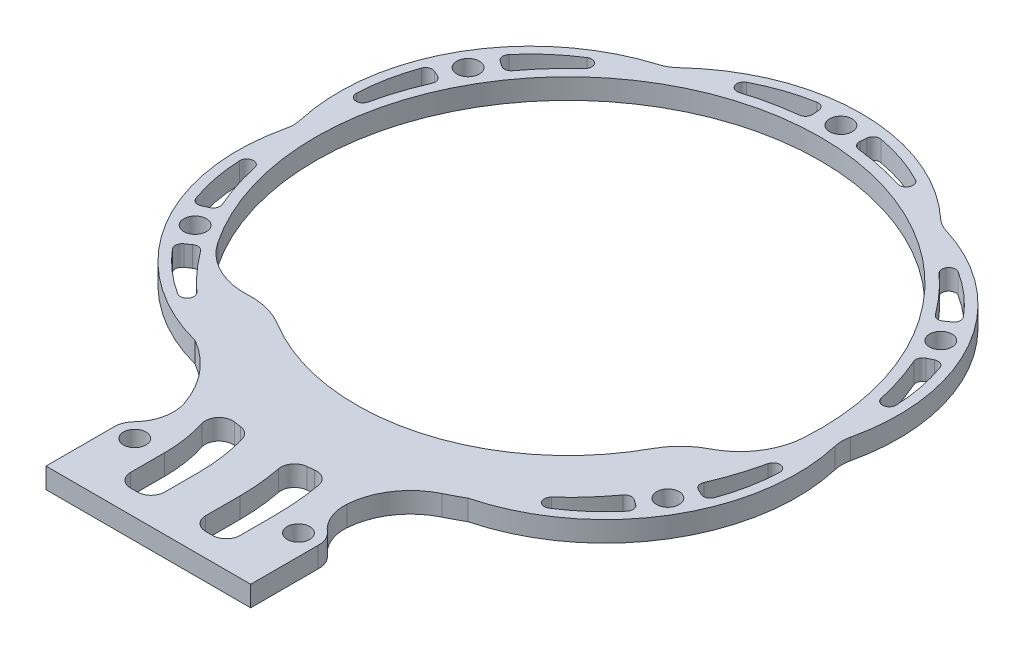
from build123d import *

# Parameters (mm, degrees)
SWEEP_2_DEPTH                   = 3
SKETCH_15_W                     = 3
SKETCH_15_H                     = 8
EXTRUDE_12_DEPTH                = 2
SKETCH_17_W                     = 3
SKETCH_17_H                     = 8
REVOLVE_1_ANGLE                 = 60
SKETCH_20_R                     = 26.546275206
EXTRUDE_1_DEPTH                 = 3
SKETCH_21_R                     = 12.5
CUT_EXTRUDE_1_DEPTH             = 10
CUT_EXTRUDE_2_REACH             = 65.063
SKETCH_22_R                     = 20
EXTRUDE_START                   = 22
SKETCH_23_R                     = 17
SKETCH_23_R_2                   = 12.5
EXTRUDE_2_DEPTH                 = 22
SKETCH_24_R                     = 55.165528931
CUT_EXTRUDE_3_DEPTH             = 67.603303222
SKETCH_25_R                     = 1.4
CUT_EXTRUDE_4_DEPTH             = 10
SKETCH_26_R                     = 3
EXTRUDE_3_DEPTH                 = 3
SKETCH_27_R                     = 1.65
CUT_EXTRUDE_5_DEPTH             = 3
SKETCH_28_R                     = 37
CUT_EXTRUDE_6_DEPTH             = 10
FILLET_1_R                      = 10
SKETCH_29_W                     = 24
SKETCH_29_H                     = 3
EXTRUDE_4_DEPTH                 = 13
SKETCH_30_R                     = 3
EXTRUDE_5_DEPTH                 = 3
SKETCH_31_R                     = 1.35
CUT_EXTRUDE_7_DEPTH             = 3
FILLET_2_R                      = 6
EXTRUDE_7_DEPTH                 = 3
EXTRUDE_START_2                 = -3
SKETCH_33_R                     = 37
SKETCH_33_R_2                   = 1.65
EXTRUDE_8_DEPTH                 = 3
CUT_EXTRUDE_START               = -10
CUT_EXTRUDE_8_DEPTH             = 10
EXTRUDE_9_DEPTH                 = 3
PATTERN_CIRCULAR_1_COUNT        = 3
PATTERN_CIRCULAR_1_ANGLE        = 120
PATTERN_START                   = -3
PATTERN_CIRCULAR_1_COPY_1_DEPTH = 3
PATTERN_CIRCULAR_1_COPY_2_DEPTH = 3
MIRROR_START                    = -3
MIRROR_2_COPY_1_DEPTH           = 3
MIRROR_2_COPY_2_DEPTH           = 3
MIRROR_2_COPY_3_DEPTH           = 3
MIRROR_2_COPY_4_DEPTH           = 3
MIRROR_2_COPY_5_DEPTH           = 3
EXTRUDE_10_DEPTH                = 3
FILLET_5_R                      = 5
MM_PRESS_1_D                    = 3.3
CUT_EXTRUDE_9_DEPTH             = 140.331676762
EXTRUDE_13_DEPTH                = 3
FILLET_7_R                      = 2
FILLET_8_R                      = 10
FILLET_9_R                      = 10


# Read off the part's stored shape, not the designer's step: 扫描2
with BuildPart() as part:
    # 扫描2 outline → 扫描2 (new body)
    with BuildSketch(Plane(origin=(0, 0, 0), x_dir=(1, 0, 0), z_dir=(0, 1, 0))):
        with BuildLine():
            ThreePointArc((-20, -34.641016151), (-14.143593539, -40.497422612), (-12, -48.497422612))
            Line((-12, -48.497422612), (12, -48.497422612))
            ThreePointArc((12, -48.497422612), (11.683405538, -43.474741562), (10.738633754, -38.531568163))
            ThreePointArc((10.738633754, -38.531568163), (5.02268105, 39.683405538), (-20, -34.641016151))
        make_face()
        with BuildLine():
            ThreePointArc((0, -19.931708898), (-3.808527847, -16.641925832), (-8, -13.856406461))
            ThreePointArc((-8, -13.856406461), (4.14110472, 15.454813221), (0, -16))
            Line((0, -16), (0, -19.931708898))
        make_face(mode=Mode.SUBTRACT)
    extrude(amount=SWEEP_2_DEPTH)

    # 扫描3: sweep along a path in 草图16
    with BuildLine(Plane(origin=(0, 3, 0), x_dir=(1, 0, 0), z_dir=(0, 1, 0))) as sweep_3_path:
        ThreePointArc((-12, -48.497422612), (-14.143593539, -40.497422612), (-20, -34.641016151))
        ThreePointArc((-20, -34.641016151), (5.02268105, 39.683405538), (10.738633754, -38.531568163))
    # 草图15 → 扫描3 (sweep)
    with BuildSketch(Plane.XY.offset(48.497422612)):
        with Locations((-10.5, 4)):
            Rectangle(SKETCH_15_W, SKETCH_15_H)
    sweep(path=sweep_3_path.line)

    # 草图42 → 凸台-拉伸12 (add)
    with BuildSketch(Plane(origin=(0, 0, 0), x_dir=(0.26846584384264915, 0, 0.9632892040762495), z_dir=(-0.9632892040762495, 0, 0.26846584384264915))):
        Polygon((37, 8), (37, 3), (38.4, 3), (40, 3), (40, 8), align=None)
    extrude(amount=EXTRUDE_12_DEPTH)

    # 草图17 → 旋转1 (revolve)
    with BuildSketch(Plane.XY.offset(48.497422612)):
        with Locations((10.5, 4)):
            Rectangle(SKETCH_17_W, SKETCH_17_H)
    revolve(axis=Axis((-28, 3, 48.497422612), (0, 1, 0)), revolution_arc=REVOLVE_1_ANGLE)

    # 草图20 → 凸台-拉伸1 (add)
    with BuildSketch(Plane(origin=(0, 3, 0), x_dir=(1, 0, 0), z_dir=(0, 1, 0))):
        Circle(SKETCH_20_R)
    extrude(amount=-EXTRUDE_1_DEPTH)

    # 草图21 → 切除-拉伸1 (cut)
    with BuildSketch(Plane(origin=(0, 3, 0), x_dir=(1, 0, 0), z_dir=(0, 1, 0))):
        with Locations(Location((0, 0, 0), (0, 0, 270))):
            Circle(SKETCH_21_R)
    extrude(amount=-CUT_EXTRUDE_1_DEPTH, mode=Mode.SUBTRACT)

    # 草图22 → 切除-拉伸2 (cut, up to next)
    with BuildSketch(Plane(origin=(0, 3, 0), x_dir=(1, 0, 0), z_dir=(0, 1, 0)), mode=Mode.PRIVATE) as cut_extrude_2_sk1:
        Circle(SKETCH_22_R)
    cut_extrude_2_tool1 = extrude(cut_extrude_2_sk1.sketch, amount=CUT_EXTRUDE_2_REACH, mode=Mode.PRIVATE) & part.part
    add(cut_extrude_2_tool1.solids().sort_by_distance((0, 3, 0))[0], mode=Mode.SUBTRACT)

    # 草图23 → 凸台-拉伸2 (add)
    with BuildSketch(Plane(origin=(0, 3, 0), x_dir=(1, 0, 0), z_dir=(0, 1, 0)).offset(EXTRUDE_START)):
        with Locations(Location((0, 0, 0), (0, 0, 270))):
            Circle(SKETCH_23_R)
        with Locations(Location((0, 0, 0), (0, 0, 270))):
            Circle(SKETCH_23_R_2, mode=Mode.SUBTRACT)
    extrude(amount=-EXTRUDE_2_DEPTH)

    # 草图24 → 切除-拉伸3 (cut, through all)
    with BuildSketch(Plane(origin=(0, 3, 0), x_dir=(1, 0, 0), z_dir=(0, 1, 0))):
        Circle(SKETCH_24_R)
    extrude(amount=CUT_EXTRUDE_3_DEPTH, mode=Mode.SUBTRACT)

    # 草图25 → 切除-拉伸4 (cut)
    with BuildSketch(Plane(origin=(0, 3, 0), x_dir=(1, 0, 0), z_dir=(0, 1, 0))):
        with Locations(Location((0, -14.75, 0), (0, 0, 270))):
            Circle(SKETCH_25_R)
        with Locations(Location((-12.773874706, 7.375, 0), (0, 0, 270))):
            Circle(SKETCH_25_R)
        with Locations(Location((12.773874706, 7.375, 0), (0, 0, 270))):
            Circle(SKETCH_25_R)
    extrude(amount=-CUT_EXTRUDE_4_DEPTH, mode=Mode.SUBTRACT)

    # 草图26 → 凸台-拉伸3 (add)
    with BuildSketch(Plane(origin=(0, 3, 0), x_dir=(1, 0, 0), z_dir=(0, 1, 0))):
        with Locations((0, 40)):
            Circle(SKETCH_26_R)
        with Locations((34.641016151, 20)):
            Circle(SKETCH_26_R)
        with Locations((34.641016151, -20)):
            Circle(SKETCH_26_R)
        with Locations((0, -40)):
            Circle(SKETCH_26_R)
        with Locations((-34.641016151, -20)):
            Circle(SKETCH_26_R)
        with Locations((-34.641016151, 20)):
            Circle(SKETCH_26_R)
    extrude(amount=-EXTRUDE_3_DEPTH)

    # 草图27 → 切除-拉伸5 (cut)
    with BuildSketch(Plane(origin=(0, 3, 0), x_dir=(1, 0, 0), z_dir=(0, 1, 0))):
        with Locations(Location((0, 40, 0), (0, 0, 270))):
            Circle(SKETCH_27_R)
        with Locations(Location((34.641016151, 20, 0), (0, 0, 270))):
            Circle(SKETCH_27_R)
        with Locations(Location((34.641016151, -20, 0), (0, 0, 270))):
            Circle(SKETCH_27_R)
        with Locations(Location((-34.641016151, -20, 0), (0, 0, 270))):
            Circle(SKETCH_27_R)
        with Locations(Location((-34.641016151, 20, 0), (0, 0, 270))):
            Circle(SKETCH_27_R)
    extrude(amount=-CUT_EXTRUDE_5_DEPTH, mode=Mode.SUBTRACT)

    # 草图28 → 切除-拉伸6 (cut)
    with BuildSketch(Plane.XZ):
        with Locations(Location((0, 0, 0), (0, 0, 270))):
            Circle(SKETCH_28_R)
    extrude(amount=-CUT_EXTRUDE_6_DEPTH, mode=Mode.SUBTRACT)

    # 圆角1
    fillet_1_edges = [part.edges().sort_by_distance(p)[0] for p in [
        (10.738633754, 1.5, 38.531568163),
    ]]
    fillet(fillet_1_edges, radius=FILLET_1_R)

    # 草图29 → 凸台-拉伸4 (add)
    with BuildSketch(Plane.XY.offset(48.497422612)):
        with Locations((0, 1.5)):
            Rectangle(SKETCH_29_W, SKETCH_29_H)
    extrude(amount=EXTRUDE_4_DEPTH)

    # 草图30 → 凸台-拉伸5 (add)
    with BuildSketch(Plane.XZ):
        with Locations((-12, 51.497422612)):
            Circle(SKETCH_30_R)
        with Locations((12, 51.497422612)):
            Circle(SKETCH_30_R)
    extrude(amount=-EXTRUDE_5_DEPTH)

    # 草图31 → 切除-拉伸7 (cut)
    with BuildSketch(Plane.XZ):
        with Locations(Location((12, 51.497422612, 0), (0, 0, 270))):
            Circle(SKETCH_31_R)
        with Locations(Location((-12, 51.497422612, 0), (0, 0, 270))):
            Circle(SKETCH_31_R)
    extrude(amount=-CUT_EXTRUDE_7_DEPTH, mode=Mode.SUBTRACT)

    # 圆角2
    # the kernel refuses this fillet: 6 mm, written as the material it adds along each edge
    with BuildSketch(Plane(origin=(-12, 0, 48.497422612), x_dir=(-0.9188891205468269, 0, 0.39451588579001345), z_dir=(0, 1, 0))) as fillet_2_piece_1:
        with BuildLine():
            CenterArc((4.73419063, -5.513334723), FILLET_2_R, 113.235784524, 62.181860715)
            ThreePointArc((-1.246630549, -5.033983053), (-0.828629151, -2.466146987), (0, 0))
            ThreePointArc((0, 0), (1.183547657, -0.243332638), (2.367095315, 0))
        make_face()
    extrude(amount=3)
    with BuildSketch(Plane(origin=(33.044643352, 3, -22.539998797), x_dir=(0.9763333982602803, 0, -0.21627088440549028), z_dir=(0, -1, 0)), Plane(origin=(36.042533235, 3, 17.347501204), x_dir=(0.6754627791459785, 0, 0.7373940832339184), z_dir=(0, -1, 0))) as fillet_2_piece_2:
        with BuildLine():
            CenterArc((4.037057174, -5.650269228), FILLET_2_R, 109.658997639, 43.86169752)
            ThreePointArc((-1.333515642, -2.975022018), (-0.636435164, -1.501102753), (0, 0))
            ThreePointArc((0, 0), (1.009264294, -0.174865386), (2.018528587, 0))
        make_face()
    extrude(amount=3)
    with BuildSketch(Plane(origin=(36.042533235, 3, -17.347501204), x_dir=(0.3966064660544948, 0, 0.9179887314579438), z_dir=(0, -1, 0)), Plane(origin=(33.044643352, 3, 22.539998797), x_dir=(-0.5966983288141339, 0, 0.8024656406291921), z_dir=(0, -1, 0)), Plane(origin=(2.997889883, 3, -39.8875), x_dir=(0.9933047948584526, 0, 0.11552309081394699), z_dir=(0, -1, 0))) as fillet_2_piece_3:
        with BuildLine():
            CenterArc((3.504734114, -5.995015577), FILLET_2_R, 92.335605783, 43.86169752)
            ThreePointArc((-0.825631791, -1.841952715), (-0.253247299, -0.992500944), (0, 0))
            ThreePointArc((0, 0), (1.63010889, -0.03322949), (3.26021778, 0))
        make_face()
    extrude(amount=3)
    with BuildSketch(Plane(origin=(-2.997889883, 3, -39.8875), x_dir=(0.30087061904832696, 0, -0.9536649676870157), z_dir=(0, -1, 0))) as fillet_2_piece_4:
        with BuildLine():
            CenterArc((4.037057174, -5.650269227), FILLET_2_R, 109.65899764, 43.861697522)
            ThreePointArc((-1.333515641, -2.975022018), (-0.636435164, -1.501102753), (0, 0))
            ThreePointArc((0, 0), (1.009264294, -0.174865386), (2.018528587, 0))
        make_face()
    extrude(amount=3)
    with BuildSketch(Plane(origin=(-36.042533235, 3, -17.347501204), x_dir=(-0.3966064660363216, 0, 0.9179887314657953), z_dir=(0, -1, 0))) as fillet_2_piece_5:
        with BuildLine():
            CenterArc((3.504734114, 5.995015577), FILLET_2_R, 223.80269669, 43.861697526)
            ThreePointArc((-0.82563179, 1.841952715), (-0.253247299, 0.992500944), (0, 0))
            ThreePointArc((0, 0), (1.63010889, 0.03322949), (3.260217781, 0))
        make_face()
    extrude(amount=3)
    with BuildSketch(Plane(origin=(-33.044643352, 3, -22.539998796), x_dir=(-0.9763333982183507, 0, -0.2162708845947773), z_dir=(0, -1, 0))) as fillet_2_piece_6:
        with BuildLine():
            CenterArc((4.037057175, 5.650269227), FILLET_2_R, 206.479304831, 43.861697526)
            ThreePointArc((-1.333515641, 2.975022019), (-0.636435164, 1.501102753), (0, 0))
            ThreePointArc((0, 0), (1.009264294, 0.174865386), (2.018528587, 0))
        make_face()
    extrude(amount=3)
    with BuildSketch(Plane(origin=(-33.044643352, 3, 22.539998796), x_dir=(0.5966983288105701, 0, 0.8024656406318421), z_dir=(0, -1, 0))) as fillet_2_piece_7:
        with BuildLine():
            CenterArc((3.504734114, 5.995015577), FILLET_2_R, 223.802696689, 43.861697528)
            ThreePointArc((-0.82563179, 1.841952715), (-0.253247299, 0.992500944), (0, 0))
            ThreePointArc((0, 0), (1.63010889, 0.03322949), (3.260217781, 0))
        make_face()
    extrude(amount=3)
    with BuildSketch(Plane(origin=(-36.042533235, 3, 17.347501203), x_dir=(-0.6754627793068153, 0, 0.7373940830865899), z_dir=(0, -1, 0))) as fillet_2_piece_8:
        with BuildLine():
            CenterArc((4.037057175, 5.650269227), FILLET_2_R, 206.479304829, 43.861697528)
            ThreePointArc((-1.333515641, 2.975022019), (-0.636435164, 1.501102753), (0, 0))
            ThreePointArc((0, 0), (1.009264294, 0.174865386), (2.018528588, 0))
        make_face()
    extrude(amount=3)
    with BuildSketch(Plane(origin=(-12, 3, 54.497422612), x_dir=(0, 0, 1), z_dir=(0, -1, 0))) as fillet_2_piece_9:
        with BuildLine():
            CenterArc((3.708203932, 6), FILLET_2_R, 221.810314896, 48.189685104)
            ThreePointArc((-0.763932023, 2), (-0.197482923, 1.070466269), (0, 0))
            Line((0, 0), (3.708203932, 0))
        make_face()
    extrude(amount=3)
    with BuildSketch(Plane(origin=(12, 3, 54.497422612), x_dir=(0, 0, 1), z_dir=(0, -1, 0))) as fillet_2_piece_10:
        with BuildLine():
            CenterArc((3.708203932, -6), FILLET_2_R, 90, 48.189685104)
            ThreePointArc((-0.763932023, -2), (-0.197482923, -1.070466269), (0, 0))
            Line((0, 0), (3.708203932, 0))
        make_face()
    extrude(amount=3)
    with BuildSketch(Plane(origin=(12, 0, 48.497422612), x_dir=(0.9371957750043113, 0, 0.3488037833998774), z_dir=(0, 1, 0))) as fillet_2_piece_11:
        with BuildLine():
            CenterArc((4.185645401, 5.62317465), FILLET_2_R, 196.491348694, 53.09448469)
            Line((-1.56753025, 3.919951256), (-2.142847815, 3.749628917))
            ThreePointArc((-2.142847815, 3.749628917), (-1.626796654, 2.367965564), (-0.562317465, -0.20928227))
            Line((-0.562317465, -0.20928227), (0.20928227, -0.562317465))
            ThreePointArc((0.20928227, -0.562317465), (1.04641135, -0.411587325), (1.88354043, -0.562317465))
            Line((1.88354043, -0.562317465), (2.092822701, 0))
        make_face()
    extrude(amount=3)

    # 草图32 → 凸台-拉伸7 (add)
    with BuildSketch(Plane.XZ):
        with BuildLine():
            Line((-26.162950904, 26.162950904), (-21.920310217, 21.920310217))
            ThreePointArc((-21.920310217, 21.920310217), (8.023390398, 29.943700615), (29.943700615, 8.023390398))
            Line((29.943700615, 8.023390398), (35.739255573, 9.576304669))
            ThreePointArc((35.739255573, 9.576304669), (9.576304669, 35.739255573), (-26.162950904, 26.162950904))
        make_face()
    extrude(amount=-EXTRUDE_7_DEPTH)

    # 草图33 → 凸台-拉伸8 (add)
    with BuildSketch(Plane(origin=(0, 3, 0), x_dir=(1, 0, 0), z_dir=(0, 1, 0)).offset(EXTRUDE_START_2)):
        with BuildLine():
            ThreePointArc((20, -34.641016151), (37.239092363, -21.5), (40, 0))
            ThreePointArc((40, 0), (37.239092363, 21.5), (20, 34.641016151))
            ThreePointArc((20, 34.641016151), (0, 43), (-20, 34.641016151))
            ThreePointArc((-20, 34.641016151), (-37.239092363, 21.5), (-40, 0))
            ThreePointArc((-40, 0), (-37.239092363, -21.5), (-20, -34.641016151))
            ThreePointArc((-20, -34.641016151), (0, -40), (20, -34.641016151))
        make_face()
        Circle(SKETCH_33_R, mode=Mode.SUBTRACT)
        with Locations(Location((34.641016151, 20, 0), (0, 0, 270))):
            Circle(SKETCH_33_R_2, mode=Mode.SUBTRACT)
        with Locations(Location((-34.641016151, -20, 0), (0, 0, 270))):
            Circle(SKETCH_33_R_2, mode=Mode.SUBTRACT)
        with Locations(Location((-34.641016151, 20, 0), (0, 0, 270))):
            Circle(SKETCH_33_R_2, mode=Mode.SUBTRACT)
        with Locations(Location((0, 40, 0), (0, 0, 270))):
            Circle(SKETCH_33_R_2, mode=Mode.SUBTRACT)
        with Locations(Location((34.641016151, -20, 0), (0, 0, 270))):
            Circle(SKETCH_33_R_2, mode=Mode.SUBTRACT)
        with BuildLine():
            Line((35.787683499, -16.688070883), (36.640757204, -17.085865685))
            ThreePointArc((36.640757204, -17.085865685), (37.447118524, -17.102997807), (38.003850346, -16.519421106))
            ThreePointArc((38.003850346, -16.519421106), (39.421833851, -10.463600437), (39.399954161, -4.244021474))
            ThreePointArc((39.399954161, -4.244021474), (39.241697198, -3.813031937), (38.907526139, -3.498187611))
            ThreePointArc((38.907526139, -3.498187611), (38.464215503, -3.81914461), (38.256253821, -4.325395195))
            ThreePointArc((38.256253821, -4.325395195), (37.188144312, -9.964533236), (35.29358526, -15.38222479))
            ThreePointArc((35.29358526, -15.38222479), (35.275014154, -16.135651629), (35.787683499, -16.688070883))
        make_face(mode=Mode.SUBTRACT)
        with BuildLine():
            Line((32.346135074, 22.649007611), (33.117172331, 23.18889371))
            ThreePointArc((33.117172331, 23.18889371), (33.535189843, 23.878657037), (33.308163506, 24.652589288))
            ThreePointArc((33.308163506, 24.652589288), (28.772660719, 28.908509361), (23.375407491, 31.999350474))
            ThreePointArc((23.375407491, 31.999350474), (22.923031122, 32.077790693), (22.483282408, 31.94581223))
            ThreePointArc((22.483282408, 31.94581223), (22.539584005, 31.401415457), (22.874029031, 30.968190065))
            ThreePointArc((22.874029031, 30.968190065), (27.223611076, 27.223611076), (30.968190065, 22.874029031))
            ThreePointArc((30.968190065, 22.874029031), (31.611391295, 22.481232562), (32.346135074, 22.649007611))
        make_face(mode=Mode.SUBTRACT)
        with BuildLine():
            Line((35.787683499, 16.688070883), (36.640757204, 17.085865685))
            ThreePointArc((36.640757204, 17.085865685), (37.447118524, 17.102997807), (38.003850346, 16.519421106))
            ThreePointArc((38.003850346, 16.519421106), (39.421833851, 10.463600437), (39.399954161, 4.244021474))
            ThreePointArc((39.399954161, 4.244021474), (39.241697198, 3.813031937), (38.907526139, 3.498187611))
            ThreePointArc((38.907526139, 3.498187611), (38.464215503, 3.81914461), (38.256253821, 4.325395195))
            ThreePointArc((38.256253821, 4.325395195), (37.188144312, 9.964533236), (35.29358526, 15.38222479))
            ThreePointArc((35.29358526, 15.38222479), (35.275014154, 16.135651629), (35.787683499, 16.688070883))
        make_face(mode=Mode.SUBTRACT)
        with BuildLine():
            Line((32.346135074, -22.649007611), (33.117172331, -23.18889371))
            ThreePointArc((33.117172331, -23.18889371), (33.535189843, -23.878657037), (33.308163506, -24.652589288))
            ThreePointArc((33.308163506, -24.652589288), (28.772660719, -28.908509361), (23.375407491, -31.999350474))
            ThreePointArc((23.375407491, -31.999350474), (22.923031122, -32.077790693), (22.483282408, -31.94581223))
            ThreePointArc((22.483282408, -31.94581223), (22.539584004, -31.401415457), (22.874029031, -30.968190065))
            ThreePointArc((22.874029031, -30.968190065), (27.223611076, -27.223611076), (30.968190065, -22.874029031))
            ThreePointArc((30.968190065, -22.874029031), (31.611391295, -22.481232562), (32.346135074, -22.649007611))
        make_face(mode=Mode.SUBTRACT)
        with BuildLine():
            Line((-35.787683499, -16.688070883), (-36.640757204, -17.085865685))
            ThreePointArc((-36.640757204, -17.085865685), (-37.447118524, -17.102997807), (-38.003850346, -16.519421106))
            ThreePointArc((-38.003850346, -16.519421106), (-39.421833851, -10.463600437), (-39.399954161, -4.244021474))
            ThreePointArc((-39.399954161, -4.244021474), (-39.241697198, -3.813031937), (-38.907526139, -3.498187611))
            ThreePointArc((-38.907526139, -3.498187611), (-38.464215503, -3.81914461), (-38.256253821, -4.325395195))
            ThreePointArc((-38.256253821, -4.325395195), (-37.188144312, -9.964533236), (-35.29358526, -15.38222479))
            ThreePointArc((-35.29358526, -15.38222479), (-35.275014154, -16.135651629), (-35.787683499, -16.688070883))
        make_face(mode=Mode.SUBTRACT)
        with BuildLine():
            Line((-32.346135074, 22.649007611), (-33.117172331, 23.18889371))
            ThreePointArc((-33.117172331, 23.18889371), (-33.535189843, 23.878657037), (-33.308163506, 24.652589288))
            ThreePointArc((-33.308163506, 24.652589288), (-28.772660719, 28.908509361), (-23.375407491, 31.999350474))
            ThreePointArc((-23.375407491, 31.999350474), (-22.923031122, 32.077790693), (-22.483282408, 31.94581223))
            ThreePointArc((-22.483282408, 31.94581223), (-22.539584004, 31.401415457), (-22.874029031, 30.968190065))
            ThreePointArc((-22.874029031, 30.968190065), (-27.223611076, 27.223611076), (-30.968190065, 22.874029031))
            ThreePointArc((-30.968190065, 22.874029031), (-31.611391295, 22.481232562), (-32.346135074, 22.649007611))
        make_face(mode=Mode.SUBTRACT)
        with BuildLine():
            Line((-35.787683499, 16.688070883), (-36.640757204, 17.085865685))
            ThreePointArc((-36.640757204, 17.085865685), (-37.447118524, 17.102997807), (-38.003850346, 16.519421106))
            ThreePointArc((-38.003850346, 16.519421106), (-39.421833851, 10.463600437), (-39.399954161, 4.244021474))
            ThreePointArc((-39.399954161, 4.244021474), (-39.241697198, 3.813031937), (-38.907526139, 3.498187611))
            ThreePointArc((-38.907526139, 3.498187611), (-38.464215503, 3.81914461), (-38.256253821, 4.325395195))
            ThreePointArc((-38.256253821, 4.325395195), (-37.188144312, 9.964533236), (-35.29358526, 15.38222479))
            ThreePointArc((-35.29358526, 15.38222479), (-35.275014154, 16.135651629), (-35.787683499, 16.688070883))
        make_face(mode=Mode.SUBTRACT)
        with BuildLine():
            Line((-32.346135074, -22.649007611), (-33.117172331, -23.18889371))
            ThreePointArc((-33.117172331, -23.18889371), (-33.535189843, -23.878657037), (-33.308163506, -24.652589288))
            ThreePointArc((-33.308163506, -24.652589288), (-28.772660719, -28.908509361), (-23.375407491, -31.999350474))
            ThreePointArc((-23.375407491, -31.999350474), (-22.923031122, -32.077790693), (-22.483282408, -31.94581223))
            ThreePointArc((-22.483282408, -31.94581223), (-22.539584005, -31.401415457), (-22.874029031, -30.968190065))
            ThreePointArc((-22.874029031, -30.968190065), (-27.223611076, -27.223611076), (-30.968190065, -22.874029031))
            ThreePointArc((-30.968190065, -22.874029031), (-31.611391295, -22.481232562), (-32.346135074, -22.649007611))
        make_face(mode=Mode.SUBTRACT)
        with BuildLine():
            Line((3.441548424, 39.337078494), (3.523584873, 40.274759395))
            ThreePointArc((3.523584873, 40.274759395), (3.91192868, 40.981654843), (4.69568684, 41.172010394))
            ThreePointArc((4.69568684, 41.172010394), (10.649173132, 39.372109797), (16.02454667, 36.243371948))
            ThreePointArc((16.02454667, 36.243371948), (16.318666076, 35.89082263), (16.424243732, 35.44399984))
            ThreePointArc((16.424243732, 35.44399984), (15.924631498, 35.220560067), (15.38222479, 35.29358526))
            ThreePointArc((15.38222479, 35.29358526), (9.964533236, 37.188144312), (4.325395195, 38.256253821))
            ThreePointArc((4.325395195, 38.256253821), (3.66362286, 38.616884191), (3.441548424, 39.337078494))
        make_face(mode=Mode.SUBTRACT)
        with BuildLine():
            Line((-3.441548424, 39.337078494), (-3.523584873, 40.274759395))
            ThreePointArc((-3.523584873, 40.274759395), (-3.91192868, 40.981654844), (-4.69568684, 41.172010394))
            ThreePointArc((-4.69568684, 41.172010394), (-10.649173132, 39.372109797), (-16.02454667, 36.243371948))
            ThreePointArc((-16.02454667, 36.243371948), (-16.318666076, 35.89082263), (-16.424243732, 35.44399984))
            ThreePointArc((-16.424243732, 35.44399984), (-15.924631498, 35.220560067), (-15.38222479, 35.29358526))
            ThreePointArc((-15.38222479, 35.29358526), (-9.964533236, 37.188144312), (-4.325395195, 38.256253821))
            ThreePointArc((-4.325395195, 38.256253821), (-3.66362286, 38.616884191), (-3.441548424, 39.337078494))
        make_face(mode=Mode.SUBTRACT)
    extrude(amount=EXTRUDE_8_DEPTH)

    # 草图34 → 切除-拉伸8 (cut)
    with BuildSketch(Plane(origin=(0, 3, 0), x_dir=(1, 0, 0), z_dir=(0, 1, 0)).offset(CUT_EXTRUDE_START)):
        with BuildLine():
            ThreePointArc((38.256253821, 4.325395195), (37.188144312, 9.964533236), (35.29358526, 15.38222479))
            ThreePointArc((35.29358526, 15.38222479), (35.275014154, 16.135651629), (35.787683499, 16.688070883))
            Line((35.787683499, 16.688070883), (36.640757204, 17.085865685))
            ThreePointArc((36.640757204, 17.085865685), (37.447118524, 17.102997807), (38.003850346, 16.519421106))
            ThreePointArc((38.003850346, 16.519421106), (39.421833851, 10.463600437), (39.399954161, 4.244021474))
            ThreePointArc((39.399954161, 4.244021474), (39.241697198, 3.813031937), (38.907526139, 3.498187611))
            ThreePointArc((38.907526139, 3.498187611), (38.464215503, 3.81914461), (38.256253821, 4.325395195))
        make_face()
        with BuildLine():
            Line((32.346135074, 22.649007611), (33.117172331, 23.18889371))
            ThreePointArc((33.117172331, 23.18889371), (33.535189843, 23.878657037), (33.308163506, 24.652589288))
            ThreePointArc((33.308163506, 24.652589288), (28.772660719, 28.908509361), (23.375407491, 31.999350474))
            ThreePointArc((23.375407491, 31.999350474), (22.923031122, 32.077790693), (22.483282408, 31.94581223))
            ThreePointArc((22.483282408, 31.94581223), (22.539584005, 31.401415457), (22.874029031, 30.968190065))
            ThreePointArc((22.874029031, 30.968190065), (27.223611076, 27.223611076), (30.968190065, 22.874029031))
            ThreePointArc((30.968190065, 22.874029031), (31.611391295, 22.481232562), (32.346135074, 22.649007611))
        make_face()
        with BuildLine():
            ThreePointArc((15.38222479, 35.29358526), (9.964533236, 37.188144312), (4.325395195, 38.256253821))
            ThreePointArc((4.325395195, 38.256253821), (3.66362286, 38.616884191), (3.441548424, 39.337078494))
            Line((3.441548424, 39.337078494), (3.523584873, 40.274759395))
            ThreePointArc((3.523584873, 40.274759395), (3.91192868, 40.981654843), (4.69568684, 41.172010394))
            ThreePointArc((4.69568684, 41.172010394), (10.649173132, 39.372109797), (16.02454667, 36.243371948))
            ThreePointArc((16.02454667, 36.243371948), (16.318666076, 35.89082263), (16.424243732, 35.44399984))
            ThreePointArc((16.424243732, 35.44399984), (15.924631498, 35.220560067), (15.38222479, 35.29358526))
        make_face()
        with BuildLine():
            Line((-3.441548424, 39.337078494), (-3.523584873, 40.274759395))
            ThreePointArc((-3.523584873, 40.274759395), (-3.91192868, 40.981654844), (-4.69568684, 41.172010394))
            ThreePointArc((-4.69568684, 41.172010394), (-10.649173132, 39.372109797), (-16.02454667, 36.243371948))
            ThreePointArc((-16.02454667, 36.243371948), (-16.318666076, 35.89082263), (-16.424243732, 35.44399984))
            ThreePointArc((-16.424243732, 35.44399984), (-15.924631498, 35.220560067), (-15.38222479, 35.29358526))
            ThreePointArc((-15.38222479, 35.29358526), (-9.964533236, 37.188144312), (-4.325395195, 38.256253821))
            ThreePointArc((-4.325395195, 38.256253821), (-3.66362286, 38.616884191), (-3.441548424, 39.337078494))
        make_face()
        with BuildLine():
            Line((35.787683499, -16.688070883), (36.640757204, -17.085865685))
            ThreePointArc((36.640757204, -17.085865685), (37.447118524, -17.102997807), (38.003850346, -16.519421106))
            ThreePointArc((38.003850346, -16.519421106), (39.421833851, -10.463600437), (39.399954161, -4.244021474))
            ThreePointArc((39.399954161, -4.244021474), (39.241697198, -3.813031937), (38.907526139, -3.498187611))
            ThreePointArc((38.907526139, -3.498187611), (38.464215503, -3.81914461), (38.256253821, -4.325395195))
            ThreePointArc((38.256253821, -4.325395195), (37.188144312, -9.964533236), (35.29358526, -15.38222479))
            ThreePointArc((35.29358526, -15.38222479), (35.275014154, -16.135651629), (35.787683499, -16.688070883))
        make_face()
        with BuildLine():
            ThreePointArc((22.874029031, -30.968190065), (27.223611076, -27.223611076), (30.968190065, -22.874029031))
            ThreePointArc((30.968190065, -22.874029031), (31.611391295, -22.481232562), (32.346135074, -22.649007611))
            Line((32.346135074, -22.649007611), (33.117172331, -23.18889371))
            ThreePointArc((33.117172331, -23.18889371), (33.535189843, -23.878657037), (33.308163506, -24.652589288))
            ThreePointArc((33.308163506, -24.652589288), (28.772660719, -28.908509361), (23.375407491, -31.999350474))
            ThreePointArc((23.375407491, -31.999350474), (22.923031122, -32.077790693), (22.483282408, -31.94581223))
            ThreePointArc((22.483282408, -31.94581223), (22.539584004, -31.401415457), (22.874029031, -30.968190065))
        make_face()
        with BuildLine():
            Line((-32.346135074, -22.649007611), (-33.117172331, -23.18889371))
            ThreePointArc((-33.117172331, -23.18889371), (-33.535189843, -23.878657037), (-33.308163506, -24.652589288))
            ThreePointArc((-33.308163506, -24.652589288), (-28.772660719, -28.908509361), (-23.375407491, -31.999350474))
            ThreePointArc((-23.375407491, -31.999350474), (-22.923031122, -32.077790693), (-22.483282408, -31.94581223))
            ThreePointArc((-22.483282408, -31.94581223), (-22.539584005, -31.401415457), (-22.874029031, -30.968190065))
            ThreePointArc((-22.874029031, -30.968190065), (-27.223611076, -27.223611076), (-30.968190065, -22.874029031))
            ThreePointArc((-30.968190065, -22.874029031), (-31.611391295, -22.481232562), (-32.346135074, -22.649007611))
        make_face()
        with BuildLine():
            ThreePointArc((-38.256253821, -4.325395195), (-37.188144312, -9.964533236), (-35.29358526, -15.38222479))
            ThreePointArc((-35.29358526, -15.38222479), (-35.275014154, -16.135651629), (-35.787683499, -16.688070883))
            Line((-35.787683499, -16.688070883), (-36.640757204, -17.085865685))
            ThreePointArc((-36.640757204, -17.085865685), (-37.447118524, -17.102997807), (-38.003850346, -16.519421106))
            ThreePointArc((-38.003850346, -16.519421106), (-39.421833851, -10.463600437), (-39.399954161, -4.244021474))
            ThreePointArc((-39.399954161, -4.244021474), (-39.241697198, -3.813031937), (-38.907526139, -3.498187611))
            ThreePointArc((-38.907526139, -3.498187611), (-38.464215503, -3.81914461), (-38.256253821, -4.325395195))
        make_face()
        with BuildLine():
            Line((-35.787683499, 16.688070883), (-36.640757204, 17.085865685))
            ThreePointArc((-36.640757204, 17.085865685), (-37.447118524, 17.102997807), (-38.003850346, 16.519421106))
            ThreePointArc((-38.003850346, 16.519421106), (-39.421833851, 10.463600437), (-39.399954161, 4.244021474))
            ThreePointArc((-39.399954161, 4.244021474), (-39.241697198, 3.813031937), (-38.907526139, 3.498187611))
            ThreePointArc((-38.907526139, 3.498187611), (-38.464215503, 3.81914461), (-38.256253821, 4.325395195))
            ThreePointArc((-38.256253821, 4.325395195), (-37.188144312, 9.964533236), (-35.29358526, 15.38222479))
            ThreePointArc((-35.29358526, 15.38222479), (-35.275014154, 16.135651629), (-35.787683499, 16.688070883))
        make_face()
        with BuildLine():
            ThreePointArc((-22.874029031, 30.968190065), (-27.223611076, 27.223611076), (-30.968190065, 22.874029031))
            ThreePointArc((-30.968190065, 22.874029031), (-31.611391295, 22.481232562), (-32.346135074, 22.649007611))
            Line((-32.346135074, 22.649007611), (-33.117172331, 23.18889371))
            ThreePointArc((-33.117172331, 23.18889371), (-33.535189843, 23.878657037), (-33.308163506, 24.652589288))
            ThreePointArc((-33.308163506, 24.652589288), (-28.772660719, 28.908509361), (-23.375407491, 31.999350474))
            ThreePointArc((-23.375407491, 31.999350474), (-22.923031122, 32.077790693), (-22.483282408, 31.94581223))
            ThreePointArc((-22.483282408, 31.94581223), (-22.539584004, 31.401415457), (-22.874029031, 30.968190065))
        make_face()
    extrude(amount=CUT_EXTRUDE_8_DEPTH, mode=Mode.SUBTRACT)

    # 草图37 → 凸台-拉伸9 (add)
    with BuildSketch(Plane(origin=(0, 3, 0), x_dir=(1, 0, 0), z_dir=(0, 1, 0)).offset(EXTRUDE_START_2)):
        with BuildLine():
            ThreePointArc((16.02454667, 36.243371948), (14.244574899, 37.469966079), (12.37119191, 38.548515494))
            ThreePointArc((12.37119191, 38.548515494), (12.763156639, 38.180344812), (12.90774964, 37.66238838))
            ThreePointArc((12.90774964, 37.66238838), (12.498738968, 36.855709005), (11.606286412, 36.708910577))
            ThreePointArc((11.606286412, 36.708910577), (13.512798402, 36.050718153), (15.38222479, 35.29358526))
            ThreePointArc((15.38222479, 35.29358526), (15.924631498, 35.220560067), (16.424243732, 35.44399984))
            ThreePointArc((16.424243732, 35.44399984), (16.318666076, 35.89082263), (16.02454667, 36.243371948))
        make_face()
    extrude_9 = extrude(amount=EXTRUDE_9_DEPTH)

    # 镜向1: 凸台-拉伸9 across plane
    add(extrude_9.mirror(Plane(origin=(0, 0, 0), x_dir=(0, 0, 1), z_dir=(1, 0, 0))))

    # 阵列(圆周)1: 凸台-拉伸9 ×3 about axis
    pattern_circular_1_axis = Axis((0, 0, 0), (0, -1, 0))
    for i in range(1, PATTERN_CIRCULAR_1_COUNT):
        add(extrude_9.rotate(pattern_circular_1_axis, i * PATTERN_CIRCULAR_1_ANGLE / (PATTERN_CIRCULAR_1_COUNT - 1)))

    # 阵列(圆周)1 copy 1 sketch → 阵列(圆周)1 copy 1 (add)
    with BuildSketch(Plane(origin=(0, 3, 0), x_dir=(-0.4999999999999978, 0, -0.8660254037844399), z_dir=(0, 1, 0)).offset(PATTERN_START)):
        with BuildLine():
            ThreePointArc((16.02454667, -36.243371948), (14.244574899, -37.469966079), (12.37119191, -38.548515494))
            ThreePointArc((12.37119191, -38.548515494), (12.763156639, -38.180344812), (12.90774964, -37.66238838))
            ThreePointArc((12.90774964, -37.66238838), (12.498738968, -36.855709005), (11.606286412, -36.708910577))
            ThreePointArc((11.606286412, -36.708910577), (13.512798402, -36.050718153), (15.38222479, -35.29358526))
            ThreePointArc((15.38222479, -35.29358526), (15.924631498, -35.220560067), (16.424243732, -35.44399984))
            ThreePointArc((16.424243732, -35.44399984), (16.318666076, -35.89082263), (16.02454667, -36.243371948))
        make_face()
    extrude(amount=PATTERN_CIRCULAR_1_COPY_1_DEPTH)

    # 阵列(圆周)1 copy 2 sketch → 阵列(圆周)1 copy 2 (add)
    with BuildSketch(Plane(origin=(0, 3, 0), x_dir=(0.5000000000000044, 0, -0.866025403784436), z_dir=(0, 1, 0)).offset(PATTERN_START)):
        with BuildLine():
            ThreePointArc((16.02454667, -36.243371948), (14.244574899, -37.469966079), (12.37119191, -38.548515494))
            ThreePointArc((12.37119191, -38.548515494), (12.763156639, -38.180344812), (12.90774964, -37.66238838))
            ThreePointArc((12.90774964, -37.66238838), (12.498738968, -36.855709005), (11.606286412, -36.708910577))
            ThreePointArc((11.606286412, -36.708910577), (13.512798402, -36.050718153), (15.38222479, -35.29358526))
            ThreePointArc((15.38222479, -35.29358526), (15.924631498, -35.220560067), (16.424243732, -35.44399984))
            ThreePointArc((16.424243732, -35.44399984), (16.318666076, -35.89082263), (16.02454667, -36.243371948))
        make_face()
    extrude(amount=PATTERN_CIRCULAR_1_COPY_2_DEPTH)

    # 镜向2 copy 1 sketch → 镜向2 copy 1 (add)
    with BuildSketch(Plane(origin=(0, 3, 0), x_dir=(-0.4999999999999978, 0, 0.8660254037844399), z_dir=(0, 1, 0)).offset(MIRROR_START)):
        with BuildLine():
            ThreePointArc((16.02454667, -36.243371948), (14.244574899, -37.469966079), (12.37119191, -38.548515494))
            ThreePointArc((12.37119191, -38.548515494), (12.763156639, -38.180344812), (12.90774964, -37.66238838))
            ThreePointArc((12.90774964, -37.66238838), (12.498738968, -36.855709005), (11.606286412, -36.708910577))
            ThreePointArc((11.606286412, -36.708910577), (13.512798402, -36.050718153), (15.38222479, -35.29358526))
            ThreePointArc((15.38222479, -35.29358526), (15.924631498, -35.220560067), (16.424243732, -35.44399984))
            ThreePointArc((16.424243732, -35.44399984), (16.318666076, -35.89082263), (16.02454667, -36.243371948))
        make_face()
    extrude(amount=MIRROR_2_COPY_1_DEPTH)

    # 镜向2 copy 2 sketch → 镜向2 copy 2 (add)
    with BuildSketch(Plane(origin=(0, 3, 0), x_dir=(0.5000000000000044, 0, 0.866025403784436), z_dir=(0, 1, 0)).offset(MIRROR_START)):
        with BuildLine():
            ThreePointArc((16.02454667, -36.243371948), (14.244574899, -37.469966079), (12.37119191, -38.548515494))
            ThreePointArc((12.37119191, -38.548515494), (12.763156639, -38.180344812), (12.90774964, -37.66238838))
            ThreePointArc((12.90774964, -37.66238838), (12.498738968, -36.855709005), (11.606286412, -36.708910577))
            ThreePointArc((11.606286412, -36.708910577), (13.512798402, -36.050718153), (15.38222479, -35.29358526))
            ThreePointArc((15.38222479, -35.29358526), (15.924631498, -35.220560067), (16.424243732, -35.44399984))
            ThreePointArc((16.424243732, -35.44399984), (16.318666076, -35.89082263), (16.02454667, -36.243371948))
        make_face()
    extrude(amount=MIRROR_2_COPY_2_DEPTH)

    # 镜向2 copy 3 sketch → 镜向2 copy 3 (add)
    with BuildSketch(Plane(origin=(0, 3, 0), x_dir=(0.4999999999999978, 0, -0.8660254037844399), z_dir=(0, 1, 0)).offset(MIRROR_START)):
        with BuildLine():
            ThreePointArc((16.02454667, 36.243371948), (14.244574899, 37.469966079), (12.37119191, 38.548515494))
            ThreePointArc((12.37119191, 38.548515494), (12.763156639, 38.180344812), (12.90774964, 37.66238838))
            ThreePointArc((12.90774964, 37.66238838), (12.498738968, 36.855709005), (11.606286412, 36.708910577))
            ThreePointArc((11.606286412, 36.708910577), (13.512798402, 36.050718153), (15.38222479, 35.29358526))
            ThreePointArc((15.38222479, 35.29358526), (15.924631498, 35.220560067), (16.424243732, 35.44399984))
            ThreePointArc((16.424243732, 35.44399984), (16.318666076, 35.89082263), (16.02454667, 36.243371948))
        make_face()
    extrude(amount=MIRROR_2_COPY_3_DEPTH)

    # 镜向2 copy 4 sketch → 镜向2 copy 4 (add)
    with BuildSketch(Plane(origin=(0, 3, 0), x_dir=(-0.5000000000000044, 0, -0.866025403784436), z_dir=(0, 1, 0)).offset(MIRROR_START)):
        with BuildLine():
            ThreePointArc((16.02454667, 36.243371948), (14.244574899, 37.469966079), (12.37119191, 38.548515494))
            ThreePointArc((12.37119191, 38.548515494), (12.763156639, 38.180344812), (12.90774964, 37.66238838))
            ThreePointArc((12.90774964, 37.66238838), (12.498738968, 36.855709005), (11.606286412, 36.708910577))
            ThreePointArc((11.606286412, 36.708910577), (13.512798402, 36.050718153), (15.38222479, 35.29358526))
            ThreePointArc((15.38222479, 35.29358526), (15.924631498, 35.220560067), (16.424243732, 35.44399984))
            ThreePointArc((16.424243732, 35.44399984), (16.318666076, 35.89082263), (16.02454667, 36.243371948))
        make_face()
    extrude(amount=MIRROR_2_COPY_4_DEPTH)

    # 镜向2 copy 5 sketch → 镜向2 copy 5 (add)
    with BuildSketch(Plane(origin=(0, 3, 0), x_dir=(-1, 0, 0), z_dir=(0, 1, 0)).offset(MIRROR_START)):
        with BuildLine():
            ThreePointArc((16.02454667, -36.243371948), (14.244574899, -37.469966079), (12.37119191, -38.548515494))
            ThreePointArc((12.37119191, -38.548515494), (12.763156639, -38.180344812), (12.90774964, -37.66238838))
            ThreePointArc((12.90774964, -37.66238838), (12.498738968, -36.855709005), (11.606286412, -36.708910577))
            ThreePointArc((11.606286412, -36.708910577), (13.512798402, -36.050718153), (15.38222479, -35.29358526))
            ThreePointArc((15.38222479, -35.29358526), (15.924631498, -35.220560067), (16.424243732, -35.44399984))
            ThreePointArc((16.424243732, -35.44399984), (16.318666076, -35.89082263), (16.02454667, -36.243371948))
        make_face()
    extrude(amount=MIRROR_2_COPY_5_DEPTH)

    # 草图38 → 凸台-拉伸10 (add)
    with BuildSketch(Plane(origin=(0, 3, 0), x_dir=(1, 0, 0), z_dir=(0, 1, 0))):
        with BuildLine():
            Line((14.999889849, -61.497422612), (14.999889849, -51.61942031))
            Line((14.999889849, -51.61942031), (14.997518401, -51.61942031))
            ThreePointArc((14.997518401, -51.61942031), (14.713138557, -52.777609775), (14, -53.733490589))
            ThreePointArc((14, -53.733490589), (12.522774425, -55.756136802), (12, -58.205626544))
            Line((12, -58.205626544), (12, -61.497422612))
            Line((12, -61.497422612), (14.999889849, -61.497422612))
        make_face()
        with BuildLine():
            ThreePointArc((-14, -53.733490589), (-14.713138557, -52.777609775), (-14.997518401, -51.61942031))
            Line((-14.997518401, -51.61942031), (-14.997518401, -61.497422612))
            Line((-14.997518401, -61.497422612), (-12, -61.497422612))
            Line((-12, -61.497422612), (-12, -58.205626544))
            ThreePointArc((-12, -58.205626544), (-12.522774425, -55.756136802), (-14, -53.733490589))
        make_face()
    extrude(amount=-EXTRUDE_10_DEPTH)

    # 圆角5
    fillet_5_edges = [part.edges().sort_by_distance(p)[0] for p in [
        (20, 1.5, -34.641016151),
        (40, 1.5, 0),
        (-20, 1.5, -34.641016151),
        (-40, 1.5, 0),
    ]]
    fillet(fillet_5_edges, radius=FILLET_5_R)

    # 大小mm Press 暗销孔1 (through all)
    with Locations(Plane(origin=(0, 3, 0), x_dir=(1, 0, 0), z_dir=(0, 1, 0))):
        with Locations((12, -51.497422612), (-12, -51.497422612)):
            Hole(MM_PRESS_1_D / 2)

    # 草图44 → 切除-拉伸9 (cut, through all)
    with BuildSketch(Plane(origin=(81.194664378, -21, -0.989898296), x_dir=(0.32280390283122534, 0, 0.9464658685430388), z_dir=(0, -1, 0))):
        with BuildLine():
            ThreePointArc((14.160637653, 83.874555913), (19.997234873, 84.560710043), (25.679315007, 86.060923347))
            Line((25.679315007, 86.060923347), (30.411644349, 87.674942861))
            ThreePointArc((30.411644349, 87.674942861), (31.561055069, 88.685883388), (31.658968281, 90.213482404))
            Line((31.658968281, 90.213482404), (31.326376666, 91.188645989))
            ThreePointArc((31.326376666, 91.188645989), (30.315436139, 92.338056708), (28.787837124, 92.43596992))
            Line((28.787837124, 92.43596992), (24.055507781, 90.821950406))
            ThreePointArc((24.055507781, 90.821950406), (18.558136353, 89.468038028), (12.909218709, 89.08869546))
            ThreePointArc((12.909218709, 89.08869546), (13.622399391, 86.502619204), (14.160637653, 83.874555913))
        make_face()
        with BuildLine():
            ThreePointArc((8.304834273, 98.905178177), (9.397586499, 97.11613036), (10.395107166, 95.272288707))
            ThreePointArc((10.395107166, 95.272288707), (16.326067504, 95.226388007), (22.118684364, 96.500745618))
            Line((22.118684364, 96.500745618), (26.851013707, 98.114765132))
            ThreePointArc((26.851013707, 98.114765132), (28.000424426, 99.125705659), (28.098337638, 100.653304674))
            Line((28.098337638, 100.653304674), (27.775533735, 101.599770543))
            ThreePointArc((27.775533735, 101.599770543), (26.764593208, 102.749181262), (25.236994192, 102.847094474))
            Line((25.236994192, 102.847094474), (20.50466485, 101.23307496))
            ThreePointArc((20.50466485, 101.23307496), (15.576715192, 100.176472459), (10.538185767, 100.296129967))
            ThreePointArc((10.538185767, 100.296129967), (9.350030831, 100.098731966), (8.490689647, 99.254806107))
            Line((8.490689647, 99.254806107), (8.304834273, 98.905178177))
        make_face()
    extrude(amount=-CUT_EXTRUDE_9_DEPTH, mode=Mode.SUBTRACT)

    # 草图43 → 凸台-拉伸13 (add)
    with BuildSketch(Plane(origin=(0, 3, 0), x_dir=(1, 0, 0), z_dir=(0, 1, 0)).offset(EXTRUDE_START_2)):
        with BuildLine():
            Line((-9.734878073, -38.797321414), (-10.005794135, -39.086088442))
            ThreePointArc((-10.005794135, -39.086088442), (-10.527142469, -40.171848102), (-10.330431889, -41.360117042))
            ThreePointArc((-10.330431889, -41.360117042), (-7.417664646, -41.980416338), (-4.468698449, -42.395846954))
            ThreePointArc((-4.468698449, -42.395846954), (-5.005373679, -40.982967913), (-5.621723938, -39.602982463))
            ThreePointArc((-5.621723938, -39.602982463), (-7.688860693, -39.254062481), (-9.734878073, -38.797321414))
        make_face()
        with BuildLine():
            ThreePointArc((1.867227926, -42.589794137), (4.459954432, -42.396767698), (7.036092736, -42.046052178))
            ThreePointArc((7.036092736, -42.046052178), (6.728997346, -40.761687545), (6.381369068, -39.487695917))
            ThreePointArc((6.381369068, -39.487695917), (3.720251451, -39.82662086), (1.042401034, -39.986415194))
            ThreePointArc((1.042401034, -39.986415194), (1.482171244, -41.279437239), (1.867227926, -42.589794137))
        make_face()
    extrude(amount=EXTRUDE_13_DEPTH)

    # 圆角7
    fillet_7_edges = [part.edges().sort_by_distance(p)[0] for p in [
        (-10.330431889, 1.5, 41.360117042),
        (-4.468698449, 1.5, 42.395846954),
        (7.036092736, 1.5, 42.046052178),
        (1.867227926, 1.5, 42.589794137),
    ]]
    fillet(fillet_7_edges, radius=FILLET_7_R)

    # 圆角8
    # the kernel refuses this fillet: 10 mm, written as the material it takes off along each edge
    with BuildSketch(Plane(origin=(-21.920310217, -18.236796634, 21.920310217), x_dir=(-0.7071067811865502, 0, 0.7071067811865449), z_dir=(0, 1, 0))) as fillet_8_piece_1:
        with BuildLine():
            CenterArc((8.864864865, 9.580842829), FILLET_8_R, 193.513772641, 59.838503827)
            Line((-0.858272907, 7.244051895), (-1.052735662, 7.197316076))
            ThreePointArc((-1.052735662, 7.197316076), (-0.413926849, 3.623827976), (-0.2, 0))
            Line((-0.2, 0), (0, -0.2))
            ThreePointArc((0, -0.2), (3, -0.2), (5.942702703, -0.191616857))
            Line((5.942702703, -0.191616857), (6, 0))
        make_face()
    extrude(amount=39.473593269, mode=Mode.SUBTRACT)
    with BuildSketch(Plane(origin=(29.943700615, -18.236796634, 8.023390398), x_dir=(-0.37066906749305556, 0, 0.9287650092482105), z_dir=(0, 1, 0))) as fillet_8_piece_2:
        with BuildLine():
            CenterArc((8.471286179, 9.930543231), FILLET_8_R, 203.404609853, 59.838503827)
            Line((-0.705940515, 5.958325939), (-0.889485049, 5.878881593))
            ThreePointArc((-0.889485049, 5.878881593), (-0.551581122, 2.955631619), (-0.198610865, -0.02353135))
            Line((-0.198610865, -0.02353135), (0.02353135, -0.198610865))
            ThreePointArc((0.02353135, -0.198610865), (3.647359327, 0.015315984), (7.271187303, -0.198610865))
            Line((7.271187303, -0.198610865), (7.294718654, 0))
        make_face()
    extrude(amount=39.473593269, mode=Mode.SUBTRACT)

    # 圆角9
    fillet_9_edges = [part.edges().sort_by_distance(p)[0] for p in [
        (35.739255573, 1.5, 9.576304669),
        (-26.162950904, 1.5, 26.162950904),
    ]]
    fillet(fillet_9_edges, radius=FILLET_9_R)


solid = part.part
